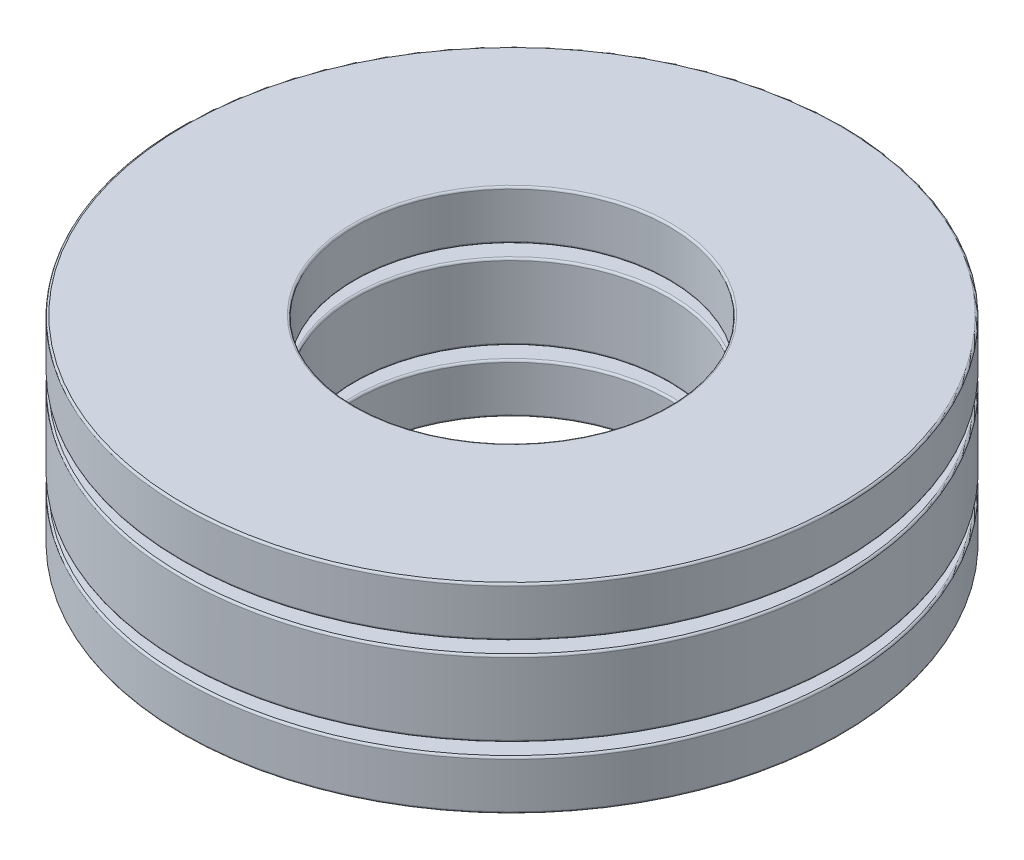
from build123d import *

# Parameters (mm, degrees)
SKETCH3_W         = 5.5
SKETCH3_H         = 2.4075
CIRPATTERN1_COUNT = 6
CIRPATTERN1_ANGLE = 300
CIRPATTERN2_COUNT = 6
SKETCH6_W         = 5.5
SKETCH6_H         = 1.57
FILLET1_R         = 0.0635
FILLET2_R         = 0.0635
FILLET3_R         = 0.0635


with BuildPart() as part:
    # Sketch3 → Revolve1 (revolve)
    with BuildSketch(Plane.XY):
        with Locations((7.75, 0)):
            Rectangle(SKETCH3_W, SKETCH3_H)
    revolve(axis=Axis((0, 3.175, 0), (0, -1, 0)))

    # Sketch4 → Cut-Revolve1 (revolve, cut)
    with BuildSketch(Plane.XY):
        with BuildLine():
            Line((7.55, 1.605), (7.55, -1.605))
            ThreePointArc((7.55, -1.605), (5.945, 0), (7.55, 1.605))
        make_face()
    cut_revolve1 = revolve(axis=Axis((7.55, 1.605, 0), (0, -1, 0)), mode=Mode.SUBTRACT)

    # CirPattern2: Cut-Revolve1 ×6 about axis
    cirpattern2_axis = Axis((0, 3.175, 0), (0, -1, 0))
    for i in range(1, CIRPATTERN2_COUNT):
        add(cut_revolve1.rotate(cirpattern2_axis, i * 360 / CIRPATTERN2_COUNT), mode=Mode.SUBTRACT)

    # Fillet2
    fillet2_edges = [part.edges().sort_by_distance(p)[0] for p in [
        (-5, -1.20375, 0),
        (-10.5, -1.20375, 0),
        (8.611607714, -1.20375, 0),
        (4.305803857, -1.20375, 7.457871047),
        (-4.305803857, -1.20375, 7.457871047),
        (-8.611607714, -1.20375, 0),
        (-4.305803857, -1.20375, -7.457871047),
        (4.305803857, -1.20375, -7.457871047),
        (-10.5, 1.20375, 0),
        (-5, 1.20375, 0),
        (8.611607714, 1.20375, 0),
        (4.305803857, 1.20375, 7.457871047),
        (-4.305803857, 1.20375, 7.457871047),
        (-8.611607714, 1.20375, 0),
        (-4.305803857, 1.20375, -7.457871047),
        (4.305803857, 1.20375, -7.457871047),
    ]]
    fillet(fillet2_edges, radius=FILLET2_R)


with BuildPart() as body_2:
    # Sketch5 → Revolve2 (revolve)
    with BuildSketch(Plane.XY):
        with BuildLine():
            Line((7.55, 1.605), (7.55, -1.605))
            ThreePointArc((7.55, -1.605), (5.945, 0), (7.55, 1.605))
        make_face()
    revolve(axis=Axis((7.55, 1.605, 0), (0, -1, 0)))


with BuildPart() as cirpattern1_1:
    # CirPattern1: pattern copy
    add(body_2.part.rotate(Axis((0, 3.175, 0), (0, -1, 0)), 1 * CIRPATTERN1_ANGLE / (CIRPATTERN1_COUNT - 1)))


with BuildPart() as cirpattern1_2:
    # CirPattern1: pattern copy
    add(body_2.part.rotate(Axis((0, 3.175, 0), (0, -1, 0)), 2 * CIRPATTERN1_ANGLE / (CIRPATTERN1_COUNT - 1)))


with BuildPart() as cirpattern1_3:
    # CirPattern1: pattern copy
    add(body_2.part.rotate(Axis((0, 3.175, 0), (0, -1, 0)), 3 * CIRPATTERN1_ANGLE / (CIRPATTERN1_COUNT - 1)))


with BuildPart() as cirpattern1_4:
    # CirPattern1: pattern copy
    add(body_2.part.rotate(Axis((0, 3.175, 0), (0, -1, 0)), 4 * CIRPATTERN1_ANGLE / (CIRPATTERN1_COUNT - 1)))


with BuildPart() as cirpattern1_5:
    # CirPattern1: pattern copy
    add(body_2.part.rotate(Axis((0, 3.175, 0), (0, -1, 0)), 5 * CIRPATTERN1_ANGLE / (CIRPATTERN1_COUNT - 1)))


with BuildPart() as body_8:
    # Sketch6 → Revolve3 (revolve)
    with BuildSketch(Plane.XY):
        with Locations((7.75, 2.39)):
            Rectangle(SKETCH6_W, SKETCH6_H)
        with Locations((7.75, -2.39)):
            Rectangle(SKETCH6_W, SKETCH6_H)
    revolve(axis=Axis((0, 3.175, 0), (0, -1, 0)))

    # Fillet1
    fillet1_edges = [body_8.edges().sort_by_distance(p)[0] for p in [
        (-5, 1.605, 0),
        (-10.5, 1.605, 0),
        (-10.5, 3.175, 0),
        (-5, 3.175, 0),
    ]]
    fillet(fillet1_edges, radius=FILLET1_R)

    # Fillet3
    fillet3_edges = [body_8.edges().sort_by_distance(p)[0] for p in [
        (-10.5, -1.605, 0),
        (-5, -1.605, 0),
        (-5, -3.175, 0),
        (-10.5, -3.175, 0),
    ]]
    fillet(fillet3_edges, radius=FILLET3_R)


solid = Compound([part.part, body_2.part, cirpattern1_1.part, cirpattern1_2.part, cirpattern1_3.part, cirpattern1_4.part, cirpattern1_5.part, body_8.part])
